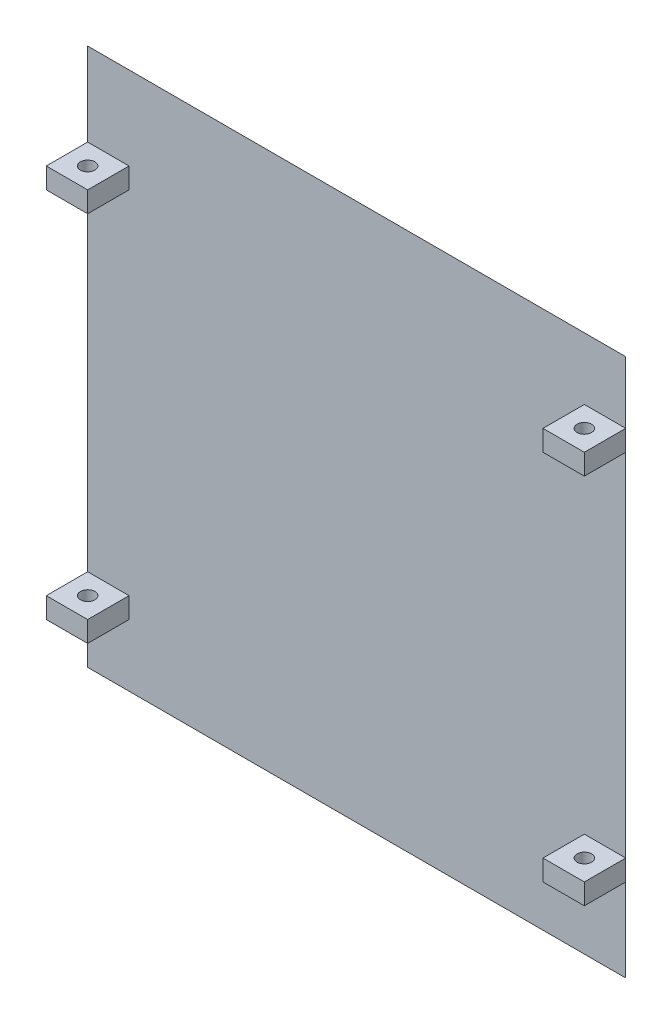
from build123d import *

# Parameters (mm, degrees)
ESQUISSE1_W             = 130
ESQUISSE1_H             = 130
BOSS_EXTRU_1_DEPTH      = 3
CHANFREIN1_SIZE         = 3
ESQUISSE2_W             = 10
ESQUISSE2_H             = 5
BOSS_EXTRU_2_DEPTH      = 10
ESQUISSE4_R             = 1.75
ENL_V_MAT_EXTRU_1_DEPTH = 175.051716452
ESQUISSE5_R             = 1.75
ENL_V_MAT_EXTRU_2_DEPTH = 171.724954239


with BuildPart() as part:
    # Esquisse1 → Boss.-Extru.1 (new body)
    with BuildSketch(Plane.XY):
        with Locations((65, 65)):
            Rectangle(ESQUISSE1_W, ESQUISSE1_H)
    extrude(amount=BOSS_EXTRU_1_DEPTH)

    # Chanfrein1
    chanfrein1_edges = [part.edges().sort_by_distance(p)[0] for p in [
        (65, 130, 0),
        (130, 65, 0),
        (65, 0, 0),
        (0, 65, 0),
    ]]
    chamfer(chanfrein1_edges, length=CHANFREIN1_SIZE - 0.0001)  # a hair under: the kernel refuses the full size

    # Esquisse2 → Boss.-Extru.2 (add)
    with BuildSketch(Plane.XY.offset(3)):
        with Locations((5, 107.4)):
            Rectangle(ESQUISSE2_W, ESQUISSE2_H)
        with Locations((5, 17.5)):
            Rectangle(ESQUISSE2_W, ESQUISSE2_H)
        with Locations((125, 22.6)):
            Rectangle(ESQUISSE2_W, ESQUISSE2_H)
        with Locations((125, 112.5)):
            Rectangle(ESQUISSE2_W, ESQUISSE2_H)
    extrude(amount=BOSS_EXTRU_2_DEPTH)

    # Esquisse4 → Enlèv. mat.-Extru.1 (cut, through all)
    with BuildSketch(Plane.XZ.offset(-15)):
        with Locations(Location((5, 8, 0), (0, 0, 270))):
            Circle(ESQUISSE4_R)
    extrude(amount=-ENL_V_MAT_EXTRU_1_DEPTH, mode=Mode.SUBTRACT)

    # Esquisse5 → Enlèv. mat.-Extru.2 (cut, through all)
    with BuildSketch(Plane.XZ.offset(-20.1)):
        with Locations(Location((125, 8, 0), (0, 0, 270))):
            Circle(ESQUISSE5_R)
    extrude(amount=-ENL_V_MAT_EXTRU_2_DEPTH, mode=Mode.SUBTRACT)


solid = part.part
